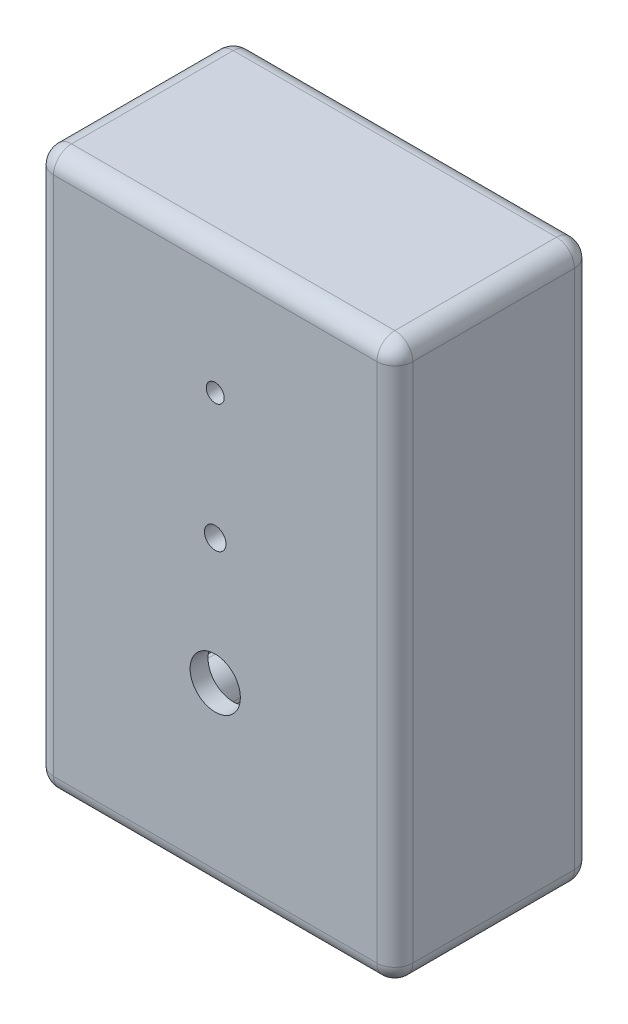
from build123d import *

# Parameters (mm, degrees)
SKETCH6_W           = 100
SKETCH6_H           = 155
BOSS_EXTRUDE5_DEPTH = 55
FILLET2_R           = 5
SHELL3_START        = -45
SHELL3_OUTLINE_W    = 145
SHELL3_OUTLINE_H    = 50
SHELL3_DEPTH        = 90
BOSS_EXTRUDE6_DEPTH = 45
SKETCH8_R           = 2.1
CUT_EXTRUDE1_DEPTH  = 6.5
SKETCH9_R           = 2.5
SKETCH9_R_2         = 3
SKETCH9_R_3         = 7
CUT_EXTRUDE2_DEPTH  = 108.383657975
CUT_EXTRUDE3_REACH  = 173.901
CUT_EXTRUDE4_START  = -3
CUT_EXTRUDE4_DEPTH  = 3
BOSS_EXTRUDE7_DEPTH = 3


# Read off the part's stored shape, not the designer's step: Shell3
with BuildPart() as part:
    # Sketch6 → Boss-Extrude5 (new body)
    with BuildSketch(Plane.XY):
        Rectangle(SKETCH6_W, SKETCH6_H)
    extrude(amount=BOSS_EXTRUDE5_DEPTH)

    # Fillet2
    fillet2_edges = [part.edges().sort_by_distance(p)[0] for p in [
        (-50, 0, 55),
        (0, -77.5, 55),
        (50, 0, 55),
        (0, -77.5, 0),
        (-50, 0, 0),
        (0, 77.5, 0),
        (50, 0, 0),
        (50, -77.5, 27.5),
        (-50, -77.5, 27.5),
        (-50, 77.5, 27.5),
        (50, 77.5, 27.5),
        (0, 77.5, 55),
    ]]
    fillet(fillet2_edges, radius=FILLET2_R)

    # Shell3 outline → Shell3 (cut)
    with BuildSketch(Plane.YZ.offset(SHELL3_START)):
        with Locations((0, 25)):
            Rectangle(SHELL3_OUTLINE_W, SHELL3_OUTLINE_H)
    extrude(amount=SHELL3_DEPTH, mode=Mode.SUBTRACT)

    # Sketch7 → Boss-Extrude6 (add)
    with BuildSketch(Plane(origin=(0, 0, 50), x_dir=(-1, 0, 0), z_dir=(0, 0, -1))):
        with BuildLine():
            Line((-45, 72.5), (-37, 72.5))
            Line((-37, 72.5), (-37, 71.5))
            ThreePointArc((-37, 71.5), (-39.050252532, 66.550252532), (-44, 64.5))
            Line((-44, 64.5), (-45, 64.5))
            Line((-45, 64.5), (-45, 72.5))
        make_face()
        with BuildLine():
            Line((45, 72.5), (37, 72.5))
            Line((37, 72.5), (37, 71.5))
            ThreePointArc((37, 71.5), (39.050252532, 66.550252532), (44, 64.5))
            Line((44, 64.5), (45, 64.5))
            Line((45, 64.5), (45, 72.5))
        make_face()
        with BuildLine():
            Line((-45, -64.5), (-44, -64.5))
            ThreePointArc((-44, -64.5), (-39.050252532, -66.550252532), (-37, -71.5))
            Line((-37, -71.5), (-37, -72.5))
            Line((-37, -72.5), (-45, -72.5))
            Line((-45, -72.5), (-45, -64.5))
        make_face()
        with BuildLine():
            Line((45, -72.5), (45, -64.5))
            Line((45, -64.5), (44, -64.5))
            ThreePointArc((44, -64.5), (39.050252532, -66.550252532), (37, -71.5))
            Line((37, -71.5), (37, -72.5))
            Line((37, -72.5), (45, -72.5))
        make_face()
    extrude(amount=BOSS_EXTRUDE6_DEPTH)

    # Sketch8 → Cut-Extrude1 (cut)
    with BuildSketch(Plane(origin=(0, 0, 5), x_dir=(-1, 0, 0), z_dir=(0, 0, -1))):
        with Locations((-42, 69.5)):
            Circle(SKETCH8_R)
        with Locations((42, 69.5)):
            Circle(SKETCH8_R)
        with Locations((42, -69.5)):
            Circle(SKETCH8_R)
        with Locations((-42, -69.5)):
            Circle(SKETCH8_R)
    extrude(amount=-CUT_EXTRUDE1_DEPTH, mode=Mode.SUBTRACT)

    # Sketch9 → Cut-Extrude2 (cut, through all)
    with BuildSketch(Plane.XY.offset(55)):
        with Locations((0, 42.5)):
            Circle(SKETCH9_R)
        with Locations((0, 7.5)):
            Circle(SKETCH9_R_2)
        with Locations((0, -27.5)):
            Circle(SKETCH9_R_3)
    extrude(amount=-CUT_EXTRUDE2_DEPTH, mode=Mode.SUBTRACT)

    # Sketch10 → Cut-Extrude3 (cut, up to next)
    with BuildSketch(Plane.XZ.offset(77.5), mode=Mode.PRIVATE) as cut_extrude3_sk1:
        with BuildLine():
            Line((-3.5, 50), (3.5, 50))
            ThreePointArc((3.5, 50), (4.914213562, 49.414213562), (5.5, 48))
            Line((5.5, 48), (5.5, 47.8))
            ThreePointArc((5.5, 47.8), (4.914213562, 46.385786438), (3.5, 45.8))
            Line((3.5, 45.8), (-3.5, 45.8))
            ThreePointArc((-3.5, 45.8), (-4.914213562, 46.385786438), (-5.5, 47.8))
            Line((-5.5, 47.8), (-5.5, 48))
            ThreePointArc((-5.5, 48), (-4.914213562, 49.414213562), (-3.5, 50))
        make_face()
    cut_extrude3_tool1 = extrude(cut_extrude3_sk1.sketch, amount=-CUT_EXTRUDE3_REACH, mode=Mode.PRIVATE) & part.part
    add(cut_extrude3_tool1.solids().sort_by_distance((0, -77.5, 47.9))[0], mode=Mode.SUBTRACT)

    # Sketch13 → Cut-Extrude4 (cut)
    with BuildSketch(Plane(origin=(0, -72.5, 0), x_dir=(1, 0, 0), z_dir=(0, 1, 0)).offset(CUT_EXTRUDE4_START)):
        with BuildLine():
            Line((5.5, -47.8), (5.5, -48))
            ThreePointArc((5.5, -48), (5.457812626, -48.408619287), (5.333030278, -48.8))
            Line((5.333030278, -48.8), (10.333030278, -48.8))
            Line((10.333030278, -48.8), (10.333030278, -50))
            Line((10.333030278, -50), (3.5, -50))
            Line((3.5, -50), (-3.5, -50))
            Line((-3.5, -50), (-10.333030278, -50))
            Line((-10.333030278, -50), (-10.333030278, -48.8))
            Line((-10.333030278, -48.8), (-5.333030278, -48.8))
            ThreePointArc((-5.333030278, -48.8), (-5.457812626, -48.408619287), (-5.5, -48))
            Line((-5.5, -48), (-5.5, -47.8))
            ThreePointArc((-5.5, -47.8), (-4.914213562, -46.385786438), (-3.5, -45.8))
            Line((-3.5, -45.8), (3.5, -45.8))
            ThreePointArc((3.5, -45.8), (4.914213562, -46.385786438), (5.5, -47.8))
        make_face()
    extrude(amount=CUT_EXTRUDE4_DEPTH, mode=Mode.SUBTRACT)

    # Sketch14 → Boss-Extrude7 (add)
    with BuildSketch(Plane(origin=(0, 0, 50), x_dir=(-1, 0, 0), z_dir=(0, 0, -1))):
        with BuildLine():
            Line((-7.5, -46.6), (7.5, -46.5))
            Line((7.5, -46.5), (7.5, -46.6))
            ThreePointArc((7.5, -46.6), (6.943502884, -47.943502884), (5.6, -48.5))
            Line((5.6, -48.5), (-5.6, -48.5))
            ThreePointArc((-5.6, -48.5), (-6.943502884, -47.943502884), (-7.5, -46.6))
        make_face()
    extrude(amount=BOSS_EXTRUDE7_DEPTH)


solid = part.part
